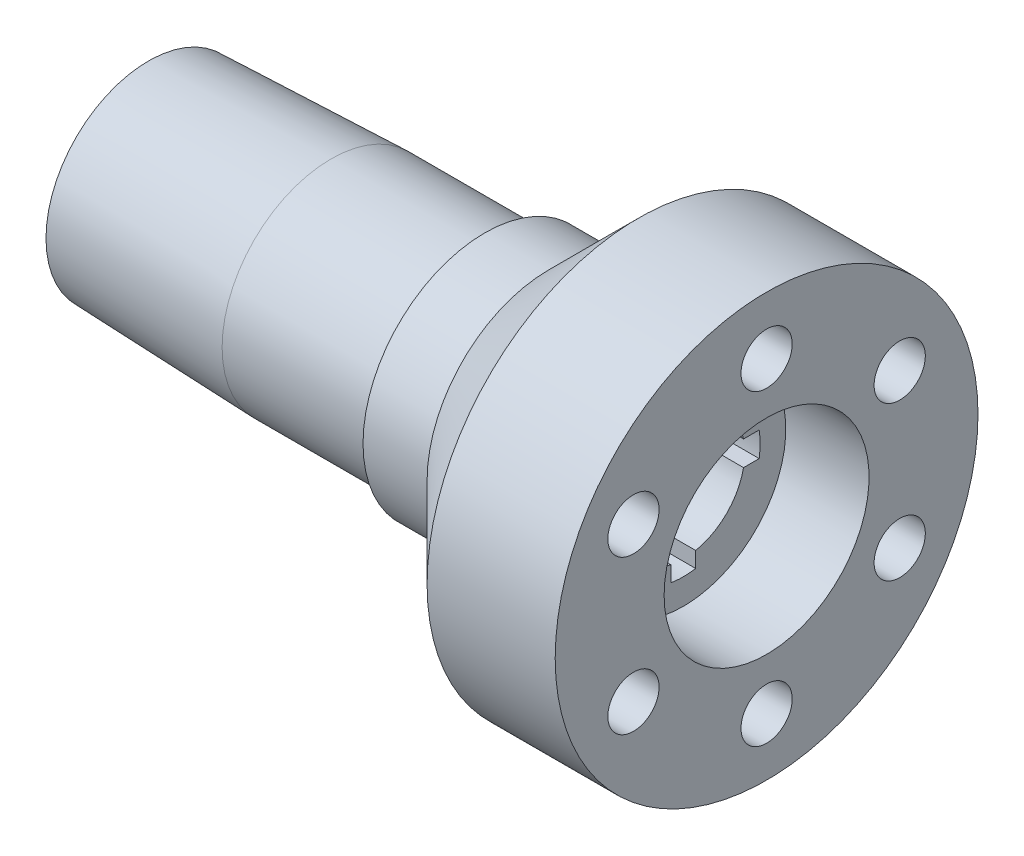
from build123d import *

# Parameters (mm, degrees)
SKETCH7_R           = 2
CUT_EXTRUDE2_DEPTH  = 8
BOSS_EXTRUDE1_DEPTH = 10


with BuildPart() as part:
    # Sketch2 → Revolve1 (revolve)
    with BuildSketch(Plane.XY):
        Polygon((0, 8), (0, 6), (41.75, 6), (41.75, 8), (48.25, 8), (48.25, 16.502402586), (38.25, 16.502402586), (31.247597414, 9.5), (26.247597414, 9.5), (26.247597414, 8.5), (14.247597414, 8.5), align=None)
    revolve(axis=Axis((0, 0, 0), (1, 0, 0)))

    # Sketch7 → Cut-Extrude2 (cut)
    with BuildSketch(Plane(origin=(48.25, 0, 0), x_dir=(0, 0, -1), z_dir=(1, 0, 0))):
        with Locations((0, 12)):
            Circle(SKETCH7_R)
        with Locations((10.392304845, 6)):
            Circle(SKETCH7_R)
        with Locations((10.392304845, -6)):
            Circle(SKETCH7_R)
        with Locations((0, -12)):
            Circle(SKETCH7_R)
        with Locations((-10.392304845, -6)):
            Circle(SKETCH7_R)
        with Locations((-10.392304845, 6)):
            Circle(SKETCH7_R)
    extrude(amount=-CUT_EXTRUDE2_DEPTH, mode=Mode.SUBTRACT)

    # Sketch8 → Boss-Extrude1 (add)
    with BuildSketch(Plane(origin=(41.75, 0, 0), x_dir=(0, 0, -1), z_dir=(1, 0, 0))):
        with BuildLine():
            ThreePointArc((-4.70147541, 0.967537581), (-3.39411255, 3.39411255), (-0.967537581, 4.70147541))
            Line((-0.967537581, 4.70147541), (-0.967537581, 5.92147541))
            ThreePointArc((-0.967537581, 5.92147541), (-4.242640687, 4.242640687), (-5.92147541, 0.967537581))
            Line((-5.92147541, 0.967537581), (-4.70147541, 0.967537581))
        make_face()
        with BuildLine():
            Line((0.967537581, 5.92147541), (0.967537581, 4.70147541))
            ThreePointArc((0.967537581, 4.70147541), (3.39411255, 3.39411255), (4.70147541, 0.967537581))
            Line((4.70147541, 0.967537581), (5.92147541, 0.967537581))
            ThreePointArc((5.92147541, 0.967537581), (4.242640687, 4.242640687), (0.967537581, 5.92147541))
        make_face()
        with BuildLine():
            ThreePointArc((-0.967537581, -4.70147541), (-3.39411255, -3.39411255), (-4.70147541, -0.967537581))
            Line((-4.70147541, -0.967537581), (-5.92147541, -0.967537581))
            ThreePointArc((-5.92147541, -0.967537581), (-4.242640687, -4.242640687), (-0.967537581, -5.92147541))
            Line((-0.967537581, -5.92147541), (-0.967537581, -4.70147541))
        make_face()
        with BuildLine():
            Line((5.92147541, -0.967537581), (4.70147541, -0.967537581))
            ThreePointArc((4.70147541, -0.967537581), (3.39411255, -3.39411255), (0.967537581, -4.70147541))
            Line((0.967537581, -4.70147541), (0.967537581, -5.92147541))
            ThreePointArc((0.967537581, -5.92147541), (4.242640687, -4.242640687), (5.92147541, -0.967537581))
        make_face()
    extrude(amount=-BOSS_EXTRUDE1_DEPTH)


solid = part.part
